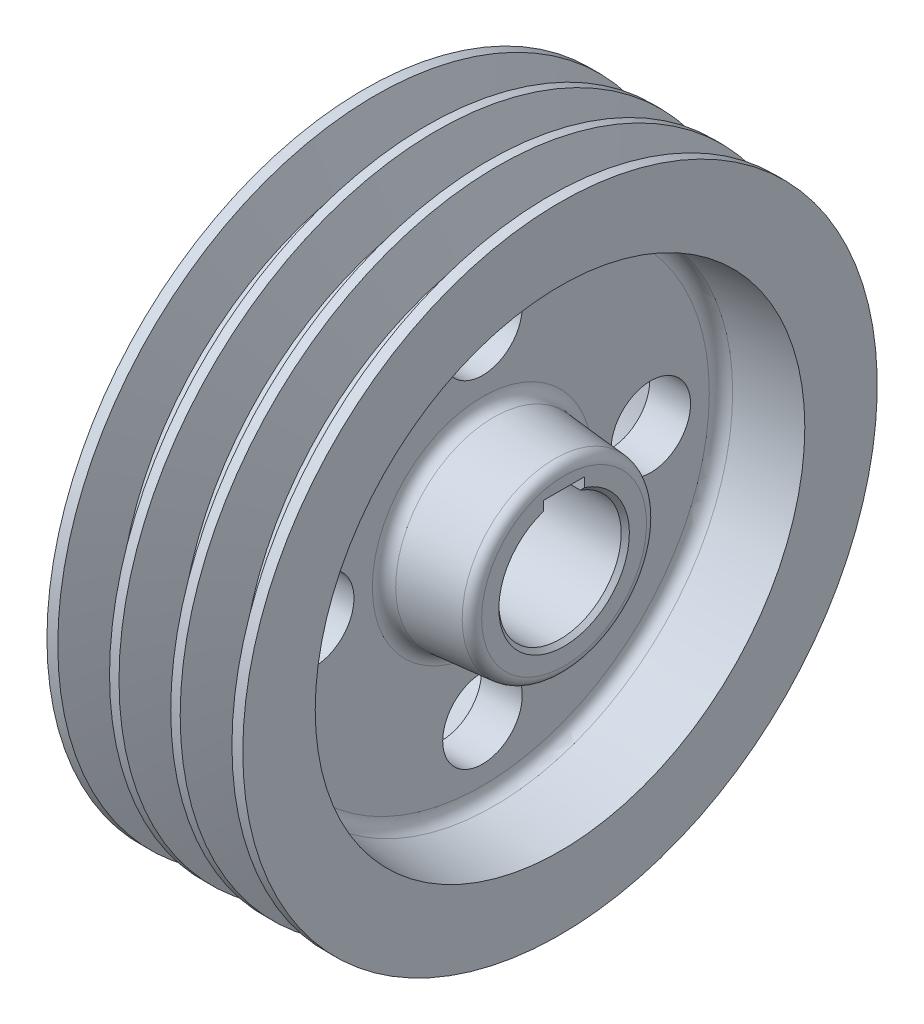
from build123d import *

# Parameters (mm, degrees)
PATTERN_LINEAR_936_COUNT    = 3
PATTERN_LINEAR_936_PITCH    = 15
CHAMFER_1_SIZE              = 1
SKETCH_4_W                  = 10
SKETCH_4_H                  = 3.357864376
CUT_EXTRUDE_1_DEPTH         = 121.789589783
FILLET_1_R                  = 3
FILLET_2_R                  = 2.5
SKETCH_5_R                  = 9.75
CUT_EXTRUDE_2_DEPTH         = 121.379088716
PATTERN_CIRCULAR_1727_COUNT = 4


with BuildPart() as part:
    # 草图1 → 旋转1 (revolve)
    with BuildSketch(Plane.XY):
        Polygon((-1, 15), (-1, 22.5), (19, 24.249773271), (19, 58.337715393), (0, 60), (0, 77.75), (48, 77.75), (48, 60), (29, 58.337715393), (29, 24.249773271), (49, 22.5), (49, 15), align=None)
    revolve(axis=Axis((0, 0, 0), (1, 0, 0)))

    # 草图2 → 切除-旋转1 (revolve, cut)
    with BuildSketch(Plane.XY):
        Polygon((11.840143071, 66.3), (15.340759374, 77.75), (2.659240626, 77.75), (6.159856929, 66.3), align=None)
    cut_revolve_1 = revolve(axis=Axis((0, 0, 0), (1, 0, 0)), mode=Mode.SUBTRACT)

    # Pattern Linear 936: 切除-旋转1 ×3
    with Locations(*[(i * PATTERN_LINEAR_936_PITCH, 0, 0) for i in range(1, PATTERN_LINEAR_936_COUNT)]):
        add(cut_revolve_1, mode=Mode.SUBTRACT)

    # 倒角1
    chamfer_1_edges = [part.edges().sort_by_distance(p)[0] for p in [
        (-1, -15, 0),
        (49, -15, 0),
    ]]
    chamfer(chamfer_1_edges, length=CHAMFER_1_SIZE)

    # 草图4 → 切除-拉伸1 (cut, through all)
    with BuildSketch(Plane.ZY.offset(1)):
        with Locations((0, 15.821067812)):
            Rectangle(SKETCH_4_W, SKETCH_4_H)
    extrude(amount=-CUT_EXTRUDE_1_DEPTH, mode=Mode.SUBTRACT)

    # 圆角1
    fillet_1_edges = [part.edges().sort_by_distance(p)[0] for p in [
        (29, -58.337715393, 0),
        (19, -24.249773271, 0),
        (19, -58.337715393, 0),
        (29, -24.249773271, 0),
    ]]
    fillet(fillet_1_edges, radius=FILLET_1_R)

    # 圆角2
    fillet_2_edges = [part.edges().sort_by_distance(p)[0] for p in [
        (49, -22.5, 0),
        (-1, -22.5, 0),
    ]]
    fillet(fillet_2_edges, radius=FILLET_2_R)

    # 草图5 → 切除-拉伸2 (cut, through all)
    with BuildSketch(Plane(origin=(0, 0, 0), x_dir=(0, 0, -1), z_dir=(1, 0, 0))):
        with Locations((0, 41.25)):
            Circle(SKETCH_5_R)
    cut_extrude_2 = extrude(amount=CUT_EXTRUDE_2_DEPTH, mode=Mode.SUBTRACT)

    # Pattern Circular 1727: 切除-拉伸2 ×4 about axis
    pattern_circular_1727_axis = Axis((0, 0, 0), (1, 0, 0))
    for i in range(1, PATTERN_CIRCULAR_1727_COUNT):
        add(cut_extrude_2.rotate(pattern_circular_1727_axis, i * 360 / PATTERN_CIRCULAR_1727_COUNT), mode=Mode.SUBTRACT)


solid = part.part
